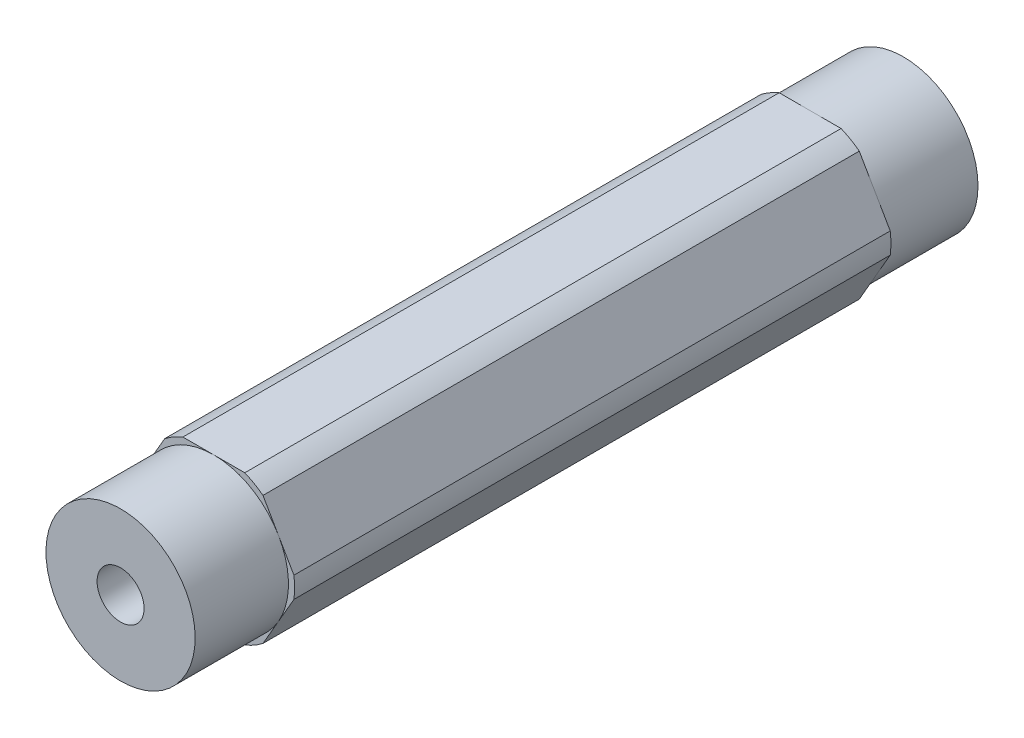
from build123d import *

# Parameters (mm, degrees)
SKETCH1_R           = 2.000000064
BOSS_EXTRUDE1_DEPTH = 25.3746
SKETCH4_R           = 6.35
SKETCH4_R_2         = 2.000000064
BOSS_EXTRUDE2_DEPTH = 7.9375


with BuildPart() as part:
    # Sketch1 → Boss-Extrude1 (new, symmetric)
    with BuildSketch(Plane.XY):
        with BuildLine():
            ThreePointArc((4.181770846, 5.456960429), (3.437499983, 5.953924622), (2.634980936, 6.35))
            Line((2.634980936, 6.35), (-2.634980936, 6.35))
            ThreePointArc((-2.634980936, 6.35), (-3.437499983, 5.953924622), (-4.181770846, 5.456960429))
            Line((-4.181770846, 5.456960429), (-6.816751782, 0.893039571))
            ThreePointArc((-6.816751782, 0.893039571), (-6.874999966, 0), (-6.816751782, -0.893039571))
            Line((-6.816751782, -0.893039571), (-4.181770846, -5.456960429))
            ThreePointArc((-4.181770846, -5.456960429), (-3.437499983, -5.953924622), (-2.634980936, -6.35))
            Line((-2.634980936, -6.35), (2.634980936, -6.35))
            ThreePointArc((2.634980936, -6.35), (3.437499983, -5.953924622), (4.181770846, -5.456960429))
            Line((4.181770846, -5.456960429), (6.816751782, -0.893039571))
            ThreePointArc((6.816751782, -0.893039571), (6.860422465, -0.447468582), (6.874999966, 0))
            ThreePointArc((6.874999966, 0), (6.860422465, 0.447468582), (6.816751782, 0.893039571))
            Line((6.816751782, 0.893039571), (4.181770846, 5.456960429))
        make_face()
        Circle(SKETCH1_R, mode=Mode.SUBTRACT)
    extrude(amount=BOSS_EXTRUDE1_DEPTH, both=True)

    # Sketch4 → Boss-Extrude2 (add)
    with BuildSketch(Plane.XY.offset(25.3746)):
        Circle(SKETCH4_R)
        Circle(SKETCH4_R_2, mode=Mode.SUBTRACT)
    boss_extrude2 = extrude(amount=BOSS_EXTRUDE2_DEPTH)

    # Mirror1: Boss-Extrude2 across plane
    add(boss_extrude2.mirror(Plane.XY))


solid = part.part
